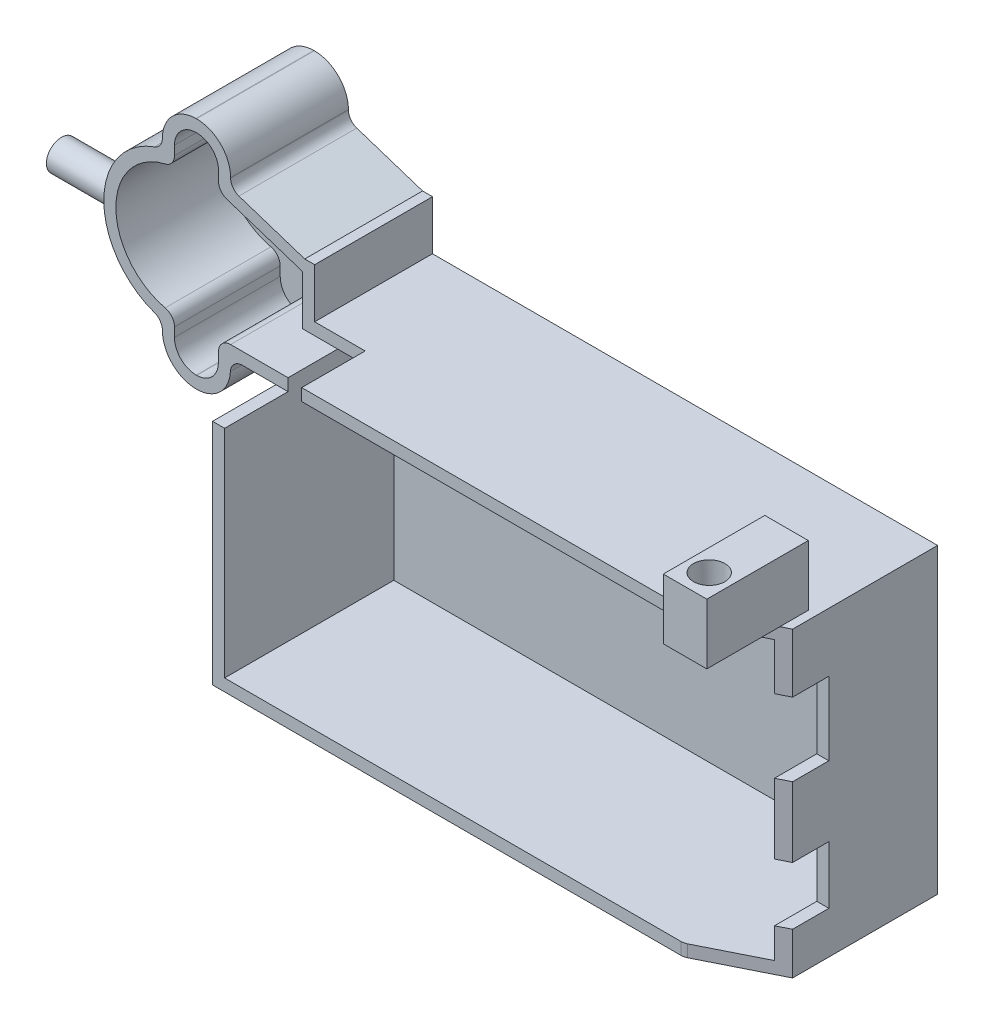
from build123d import *

# Parameters (mm, degrees)
BOSS_EXTRUDE1_DEPTH      = 19.05
SHELL3_START             = -16.51
SHELL3_DEPTH             = 35.56
SKETCH7_W                = 9.144
SKETCH7_H                = 21.336
SKETCH7_R                = 3.302
BOSS_EXTRUDE3_DEPTH      = 12.7
CHAMFER1_SIZE            = 15.24
CHAMFER1_SIZE_2          = 7.62
CUT_EXTRUDE4_DEPTH       = 13.335
BOSS_EXTRUDE4_DEPTH      = 1.27
BOSS_EXTRUDE4_DEPTH_BACK = 12.7
SKETCH9_R                = 3.175
CUT_EXTRUDE5_DEPTH       = 2.54
FILLET1_R                = 2.54
FILLET2_R                = 2.54


# Read off the part's stored shape, not the designer's step: Shell3
with BuildPart() as part:
    # Sketch1 → Boss-Extrude1 (new, symmetric)
    with BuildSketch(Plane.XY):
        with BuildLine():
            Line((-57.15, -31.75), (57.15, -31.75))
            Line((57.15, -31.75), (57.15, 31.75))
            Line((57.15, 31.75), (-49.022, 31.75))
            Line((-49.022, 31.75), (-49.022, 42.144910037))
            Line((-49.022, 42.144910037), (-51.100806987, 42.144910037))
            Line((-51.100806987, 42.144910037), (-66.686518268, 47.249120101))
            Line((-66.686518268, 47.249120101), (-66.686518268, 49.174694101))
            ThreePointArc((-66.686518268, 49.174694101), (-68.789611639, 54.223594812), (-73.855077994, 56.286469196))
            Line((-73.855077994, 56.286469196), (-73.968197446, 56.286469196))
            ThreePointArc((-73.968197446, 56.286469196), (-78.960538431, 54.18360073), (-81.02363772, 49.174694101))
            Line((-81.02363772, 49.174694101), (-81.02363772, 47.249120101))
            ThreePointArc((-81.02363772, 47.249120101), (-93.341814168, 31.674687064), (-81.02363772, 16.100254027))
            Line((-81.02363772, 16.100254027), (-81.02363772, 14.174680027))
            ThreePointArc((-81.02363772, 14.174680027), (-78.940581148, 9.145736599), (-73.91163772, 7.062680027))
            Line((-73.91163772, 7.062680027), (-73.798518268, 7.062680027))
            ThreePointArc((-73.798518268, 7.062680027), (-68.74596031, 9.210475671), (-66.728346573, 14.31641367))
            Line((-66.728346573, 14.31641367), (-66.687998915, 16.24156491))
            Line((-66.687998915, 16.24156491), (-57.15, 16.24156491))
            Line((-57.15, 16.24156491), (-57.15, -31.75))
        make_face()
    extrude(amount=BOSS_EXTRUDE1_DEPTH, both=True)

    # Shell3 outline → Shell3 (cut)
    with BuildSketch(Plane.XY.offset(SHELL3_START)):
        with BuildLine():
            Line((54.61, 29.21), (-51.562, 29.21))
            Line((-51.562, 29.21), (-51.562, 39.623206475))
            Line((-51.562, 39.623206475), (-69.226518268, 45.408211104))
            Line((-69.226518268, 45.408211104), (-69.226518268, 49.174694101))
            ThreePointArc((-69.226518268, 49.174694101), (-70.581699125, 52.423579848), (-73.843866737, 53.746469196))
            Line((-73.843866737, 53.746469196), (-73.956986189, 53.746469196))
            ThreePointArc((-73.956986189, 53.746469196), (-77.160523467, 52.391513244), (-78.48363772, 49.174694101))
            Line((-78.48363772, 49.174694101), (-78.48363772, 45.090596577))
            ThreePointArc((-78.48363772, 45.090596577), (-90.801814168, 31.674687064), (-78.48363772, 18.258777551))
            Line((-78.48363772, 18.258777551), (-78.48363772, 14.174680027))
            ThreePointArc((-78.48363772, 14.174680027), (-77.144529924, 10.941787823), (-73.91163772, 9.602680027))
            Line((-73.91163772, 9.602680027), (-73.806528971, 9.602680027))
            ThreePointArc((-73.806528971, 9.602680027), (-70.546554352, 11.002273539), (-69.268997314, 14.311978137))
            Line((-69.268997314, 14.311978137), (-69.175322928, 18.78156491))
            Line((-69.175322928, 18.78156491), (-54.61, 18.78156491))
            Line((-54.61, 18.78156491), (-54.61, -29.21))
            Line((-54.61, -29.21), (54.61, -29.21))
            Line((54.61, -29.21), (54.61, 29.21))
        make_face()
    extrude(amount=SHELL3_DEPTH, mode=Mode.SUBTRACT)

    # Sketch7 → Boss-Extrude3 (add)
    with BuildSketch(Plane(origin=(0, 31.75, 0), x_dir=(1, 0, 0), z_dir=(0, 1, 0))):
        with Locations((50.8, -17.018)):
            Rectangle(SKETCH7_W, SKETCH7_H)
        with Locations(Location((50.8, -22.606, 0), (0, 0, 180))):
            Circle(SKETCH7_R, mode=Mode.SUBTRACT)
    extrude(amount=BOSS_EXTRUDE3_DEPTH)

    # Chamfer1
    # the kernel refuses this chamfer: 15.24, 7.62 mm, written as the material it takes off along each edge
    with BuildSketch(Plane(origin=(57.15, -71.218992037, 19.05), x_dir=(-0.9998508956747117, 0, 0.017268075123668167), z_dir=(0, 1, 0))) as chamfer1_piece_1:
        Polygon((CHAMFER1_SIZE * 0.999850895675, -CHAMFER1_SIZE * 0.0172680751237), (-CHAMFER1_SIZE_2 * 0.0172680751237, -CHAMFER1_SIZE_2 * 0.999850895675), (0, 0), align=None)
    extrude(amount=102.968992037, mode=Mode.SUBTRACT)

    # Sketch8 → Cut-Extrude4 (cut)
    with BuildSketch(Plane.XY.offset(19.05)):
        with BuildLine():
            Line((-66.610527579, 49.002799892), (-66.610527579, 47.279305102))
            Line((-66.610527579, 47.279305102), (-51.100806987, 42.144910037))
            Line((-51.100806987, 42.144910037), (-38.403655113, 42.144910037))
            Line((-38.403655113, 42.144910037), (-38.403655113, 16.24156491))
            Line((-38.403655113, 16.24156491), (-66.687998915, 16.24156491))
            Line((-66.687998915, 16.24156491), (-66.726931852, 14.174565202))
            ThreePointArc((-66.726931852, 14.174565202), (-67.907528646, 10.164808506), (-71.108849398, 7.477150977))
            ThreePointArc((-71.108849398, 7.477150977), (-77.894512097, 8.119410548), (-81.02363772, 14.174680027))
            Line((-81.02363772, 14.174680027), (-81.02363772, 16.100254027))
            ThreePointArc((-81.02363772, 16.100254027), (-93.341814168, 31.674687064), (-81.02363772, 47.249120101))
            Line((-81.02363772, 47.249120101), (-81.02363772, 49.174694101))
            ThreePointArc((-81.02363772, 49.174694101), (-80.441084846, 51.993712411), (-78.788861502, 54.350912042))
            ThreePointArc((-78.788861502, 54.350912042), (-70.907499507, 55.757912789), (-66.610527579, 49.002799892))
        make_face()
    extrude(amount=-CUT_EXTRUDE4_DEPTH, mode=Mode.SUBTRACT)

    # Sketch9 → Boss-Extrude4 (add, two sides: drawn at the far end of the back side and taken through both)
    with BuildSketch(Plane(origin=(-93.341814168, 0, 0), x_dir=(0, 0, -1), z_dir=(1, 0, 0)).offset(-BOSS_EXTRUDE4_DEPTH_BACK)):
        with Locations(Location((-1.905, 31.75, 0), (0, 0, 90))):
            Circle(SKETCH9_R)
    extrude(amount=BOSS_EXTRUDE4_DEPTH + BOSS_EXTRUDE4_DEPTH_BACK)

    # Sketch10 → Cut-Extrude5 (cut)
    with BuildSketch(Plane(origin=(57.15, 0, 0), x_dir=(0, 0, -1), z_dir=(1, 0, 0))):
        Polygon((-19.05, -29.21), (-13.314117838, -29.21), (-13.314117838, -22.878143144), (-3.81, -22.878143144), (-3.81, -10.729059706), (-13.314117838, -10.729059706), (-13.314117838, 3.974723841), (-3.81, 3.974723841), (-3.81, 19.366104348), (-13.314117838, 19.366104348), (-13.314117838, 29.21), (-19.05, 29.21), align=None)
    extrude(amount=-CUT_EXTRUDE5_DEPTH, mode=Mode.SUBTRACT)

    # Fillet1
    fillet1_edges = [part.edges().sort_by_distance(p)[0] for p in [
        (-81.02363772, 16.100254027, -6.6675),
        (-78.48363772, 18.258777551, -5.3975),
        (-69.175322928, 18.78156491, -5.3975),
        (-66.687998915, 16.24156491, -6.6675),
        (-69.226518268, 45.408211104, -5.3975),
        (-66.686518268, 47.249120101, -6.6675),
        (-81.02363772, 47.249120101, -6.6675),
        (-78.48363772, 45.090596577, -5.3975),
    ]]
    fillet(fillet1_edges, radius=FILLET1_R)

    # Fillet2
    fillet2_edges = [part.edges().sort_by_distance(p)[0] for p in [
        (41.91, 30.48, 19.05),
        (41.91, -30.48, 19.05),
    ]]
    fillet(fillet2_edges, radius=FILLET2_R)


solid = part.part
